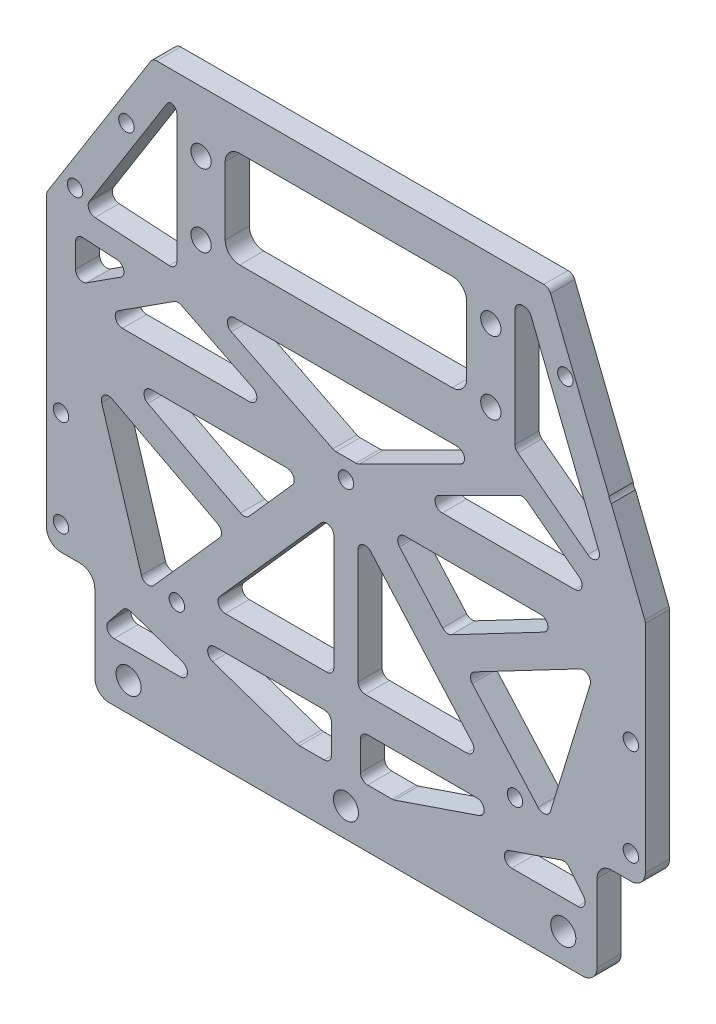
from build123d import *

# Parameters (mm, degrees)
SKETCH_1_W          = 124
SKETCH_1_H          = 120
EXTRUDE_1_DEPTH     = 5
SKETCH_2_R          = 1.6
CUT_EXTRUDE_1_DEPTH = 87.423376467
SKETCH_3_R          = 1.6
CUT_EXTRUDE_2_DEPTH = 87.423376467
SKETCH_4_R          = 2.1
CUT_EXTRUDE_3_DEPTH = 87.423376467
CHAMFER_1_SIZE      = 22
CHAMFER_1_SIZE2     = 35
CHAMFER_2_SIZE      = 50
CHAMFER_2_SIZE2     = 20
SKETCH_7_R          = 2.6
CUT_EXTRUDE_4_DEPTH = 87.423376467
SKETCH_8_R          = 1.6
CUT_EXTRUDE_5_DEPTH = 87.423376467
SKETCH_9_W          = 50
SKETCH_9_H          = 20
CUT_EXTRUDE_6_DEPTH = 10
FILLET_2_R          = 1.5
FILLET_3_R          = 3
EXTRUDE_2_DEPTH     = 5
CUT_EXTRUDE_7_DEPTH = 87.423376467
FILLET_4_R          = 3


with BuildPart() as part:
    # 草图1 → 凸台-拉伸1 (new body)
    with BuildSketch(Plane.XY):
        Rectangle(SKETCH_1_W, SKETCH_1_H)
    extrude(amount=EXTRUDE_1_DEPTH)

    # 草图2 → 切除-拉伸1 (cut, through all)
    with BuildSketch(Plane.XY.offset(5)):
        with Locations((-35, -35)):
            Circle(SKETCH_2_R)
        with Locations((35, -35)):
            Circle(SKETCH_2_R)
    extrude(amount=-CUT_EXTRUDE_1_DEPTH, mode=Mode.SUBTRACT)

    # 草图3 → 切除-拉伸2 (cut, through all)
    with BuildSketch(Plane.XY.offset(5)):
        with Locations((0, 4.5)):
            Circle(SKETCH_3_R)
    extrude(amount=-CUT_EXTRUDE_2_DEPTH, mode=Mode.SUBTRACT)

    # 草图4 → 切除-拉伸3 (cut, through all)
    with BuildSketch(Plane.XY.offset(5)):
        with Locations((-30, 47.5)):
            Circle(SKETCH_4_R)
        with Locations((30, 32.5)):
            Circle(SKETCH_4_R)
        with Locations((30, 47.5)):
            Circle(SKETCH_4_R)
        with Locations((-30, 32.5)):
            Circle(SKETCH_4_R)
    extrude(amount=-CUT_EXTRUDE_3_DEPTH, mode=Mode.SUBTRACT)

    # 倒角1
    chamfer_1_edges = [part.edges().sort_by_distance(p)[0] for p in [
        (-62, 60, 2.5),
    ]]
    chamfer_1_side = [part.faces().sort_by_distance(p)[0] for p in [
        (0, 60, 2.5),
    ]]
    chamfer(chamfer_1_edges, length=CHAMFER_1_SIZE, length2=CHAMFER_1_SIZE2, reference=chamfer_1_side[0])

    # 倒角2
    chamfer_2_edges = [part.edges().sort_by_distance(p)[0] for p in [
        (62, 60, 2.5),
    ]]
    chamfer_2_side = [part.faces().sort_by_distance(p)[0] for p in [
        (62, 0, 2.5),
    ]]
    chamfer(chamfer_2_edges, length=CHAMFER_2_SIZE, length2=CHAMFER_2_SIZE2, reference=chamfer_2_side[0])

    # 草图7 → 切除-拉伸4 (cut, through all)
    with BuildSketch(Plane.XY.offset(5)):
        with Locations((-45, -54)):
            Circle(SKETCH_7_R)
        with Locations((0, -54)):
            Circle(SKETCH_7_R)
        with Locations((45, -54)):
            Circle(SKETCH_7_R)
    extrude(amount=-CUT_EXTRUDE_4_DEPTH, mode=Mode.SUBTRACT)

    # 草图8 → 切除-拉伸5 (cut, through all)
    with BuildSketch(Plane(origin=(0, 0, 0), x_dir=(-1, 0, 0), z_dir=(0, 0, -1))):
        with Locations((-59, -33)):
            Circle(SKETCH_8_R)
        with Locations((-59, -13)):
            Circle(SKETCH_8_R)
        with Locations((45.442663531, 45.703937126)):
            Circle(SKETCH_8_R)
        with Locations((56.086094435, 28.771206142)):
            Circle(SKETCH_8_R)
    cut_extrude_5 = extrude(amount=-CUT_EXTRUDE_5_DEPTH, mode=Mode.SUBTRACT)

    # 草图9 → 切除-拉伸6 (cut)
    with BuildSketch(Plane.XY.offset(5)):
        Polygon((-20.795143669, -12.937322966), (-8.888654966, 0.5), (-46.405227211, 0.5), align=None)
        Polygon((46.405227211, 0.5), (8.888654966, 0.5), (20.795143669, -12.937322966), align=None)
        Polygon((36.651188431, 20.030509243), (13.590169944, 8.5), (51.861647432, 8.5), align=None)
        Polygon((-51.376856395, 8.5), (-13.590169944, 8.5), (-34.845181073, 19.127505564), align=None)
        Polygon((-2.409830056, 8.5), (2.409830056, 8.5), (29.409830056, 22), (-29.409830056, 22), align=None)
        with Locations((0, 42)):
            Rectangle(SKETCH_9_W, SKETCH_9_H)
        Polygon((56, -48), (56, -9.733809511), (47.224115046, -38.355523672), align=None)
        Polygon((-56, 20.766320607), (-56, 11.472020889), (-42.786156177, 19.966634775), align=None)
        Polygon((-47.224115046, -38.355523672), (-56, -9.733809511), (-56, -48), align=None)
        Polygon((-54.483388829, 25.683685076), (-35, 24.504573971), (-35, 54), (-36.684562306, 54), align=None)
        Polygon((-41.557478496, -36.369100842), (-24.893558667, -17.562677034), (-51.624213171, -3.53740308), align=None)
        Polygon((51.624213171, -3.53740308), (24.893558667, -17.562677034), (41.557478496, -36.369100842), align=None)
        Polygon((51.155461986, -48), (45.560495731, -41.070588478), (25.28565897, -48), align=None)
        Polygon((35, 27.556493075), (54.396821993, 12.852450597), (37.937802231, 54), (35, 54), align=None)
        Polygon((-25.28565897, -48), (-45.560495731, -41.070588478), (-51.155461986, -48), align=None)
        Polygon((9.825265002, -48), (36.158457982, -39), (3, -39), (3, -48), align=None)
        Polygon((-3, -39), (-36.158457982, -39), (-9.825265002, -48), (-3, -48), align=None)
        Polygon((2.5, -32), (28.333508776, -32), (2.5, -2.845040096), align=None)
        Polygon((-2.5, -32), (-2.5, -2.845040096), (-28.333508776, -32), align=None)
    extrude(amount=-CUT_EXTRUDE_6_DEPTH, mode=Mode.SUBTRACT)

    # 圆角2
    # the kernel refuses this fillet: 1.5 mm, written as the material it adds along each edge
    with BuildSketch(Plane(origin=(-20.795143669, -12.937322966, 5), x_dir=(-0.8855113060794975, 0.46461782876400964, 0), z_dir=(0, 0, -1))) as fillet_2_piece_1:
        with BuildLine():
            CenterArc((FILLET_2_R * 0.783284708727, FILLET_2_R), FILLET_2_R, 193.857889439, 76.142110561)
            Line((-FILLET_2_R * 0.187608070565, FILLET_2_R * 0.760485467833), (0, 0))
            Line((0, 0), (FILLET_2_R * 0.783284708727, 0))
        make_face()
    extrude(amount=5)
    with BuildSketch(Plane(origin=(-46.405227211, 0.5, 5), x_dir=(0.8855113060794989, -0.4646178287640068, 0), z_dir=(0, 0, -1))) as fillet_2_piece_2:
        with BuildLine():
            CenterArc((FILLET_2_R * 4.05819835002, -FILLET_2_R), FILLET_2_R, 90, 152.314508611)
            Line((FILLET_2_R * 3.59358052125, -FILLET_2_R * 1.88551130608), (0, 0))
            Line((0, 0), (FILLET_2_R * 4.05819835002, 0))
        make_face()
    extrude(amount=5)
    with BuildSketch(Plane(origin=(-8.888654966, 0.5, 5), x_dir=(-1, 0, 0), z_dir=(0, 0, -1)), Plane(origin=(-28.333508776, -32, 5), x_dir=(1, 0, 0), z_dir=(0, 0, -1)), Plane(origin=(28.333508776, -32, 5), x_dir=(-0.6631869212816371, 0.7484538111607045, 0), z_dir=(0, 0, -1)), Plane(origin=(8.888654966, 0.5, 5), x_dir=(0.663186921281637, -0.7484538111607046, 0), z_dir=(0, 0, -1))) as fillet_2_piece_3:
        with BuildLine():
            CenterArc((FILLET_2_R * 2.22216374141, -FILLET_2_R), FILLET_2_R, 90, 131.543380828)
            Line((FILLET_2_R * 1.47370993025, -FILLET_2_R * 1.66318692128), (0, 0))
            Line((0, 0), (FILLET_2_R * 2.22216374141, 0))
        make_face()
    extrude(amount=5)
    with BuildSketch(Plane(origin=(-47.224115046, -38.355523672, 5), x_dir=(-0.2931459684588604, 0.9560676969630952, 0), z_dir=(0, 0, -1)), Plane(origin=(47.224115046, -38.355523672, 5), x_dir=(0.673016151793855, -0.7396277843784607, 0), z_dir=(0, 0, -1))) as fillet_2_piece_4:
        with BuildLine():
            CenterArc((FILLET_2_R * 0.569773364902, -FILLET_2_R), FILLET_2_R, 90, 59.346676613)
            Line((-FILLET_2_R * 0.290494540513, -FILLET_2_R * 0.490157739185), (0, 0))
            Line((0, 0), (FILLET_2_R * 0.569773364902, 0))
        make_face()
    extrude(amount=5)
    with BuildSketch(Plane(origin=(-56, -48, 5), x_dir=(0.6730161517938523, 0.7396277843784631, 0), z_dir=(0, 0, -1)), Plane(origin=(56, -48, 5), x_dir=(0, 1, 0), z_dir=(0, 0, -1))) as fillet_2_piece_5:
        with BuildLine():
            CenterArc((FILLET_2_R * 2.58482323157, -FILLET_2_R), FILLET_2_R, 90, 137.699718158)
            Line((FILLET_2_R * 1.91180707978, -FILLET_2_R * 1.73962778438), (0, 0))
            Line((0, 0), (FILLET_2_R * 2.58482323157, 0))
        make_face()
    extrude(amount=5)
    with BuildSketch(Plane(origin=(-56, -9.733809511, 5), x_dir=(0.2931459684588615, -0.956067696963095, 0), z_dir=(0, 0, -1)), Plane(origin=(56, -9.733809511, 5), x_dir=(0, -1, 0), z_dir=(0, 0, -1))) as fillet_2_piece_6:
        with BuildLine():
            CenterArc((FILLET_2_R * 6.6726747335, FILLET_2_R), FILLET_2_R, 107.046394772, 162.953605228)
            Line((FILLET_2_R * 6.37952876504, FILLET_2_R * 1.95606769696), (0, 0))
            Line((0, 0), (FILLET_2_R * 6.6726747335, 0))
        make_face()
    extrude(amount=5)
    with BuildSketch(Plane(origin=(-2.5, -2.845040096, 5), x_dir=(-0.663186921281637, -0.7484538111607046, 0), z_dir=(0, 0, -1)), Plane(origin=(2.5, -2.845040096, 5), x_dir=(0, -1, 0), z_dir=(0, 0, -1))) as fillet_2_piece_7:
        with BuildLine():
            CenterArc((FILLET_2_R * 2.63644193673, -FILLET_2_R), FILLET_2_R, 90, 138.456619172)
            Line((FILLET_2_R * 1.97325501545, -FILLET_2_R * 1.74845381116), (0, 0))
            Line((0, 0), (FILLET_2_R * 2.63644193673, 0))
        make_face()
    extrude(amount=5)
    with BuildSketch(Plane(origin=(-2.5, -32, 5), x_dir=(-1, 0, 0), z_dir=(0, 0, -1)), Plane(origin=(2.5, -32, 5), x_dir=(0, 1, 0), z_dir=(0, 0, -1)), Plane(origin=(-3, -48, 5), x_dir=(-1, 0, 0), z_dir=(0, 0, -1))) as fillet_2_piece_8:
        with BuildLine():
            CenterArc((FILLET_2_R, FILLET_2_R), FILLET_2_R, 180, 90)
            Line((0, FILLET_2_R), (0, 0))
            Line((0, 0), (FILLET_2_R, 0))
        make_face()
    extrude(amount=5)
    with BuildSketch(Plane(origin=(3, -48, 5), x_dir=(1, 0, 0), z_dir=(0, 0, -1)), Plane(origin=(3, -39, 5), x_dir=(0, -1, 0), z_dir=(0, 0, -1)), Plane(origin=(-3, -39, 5), x_dir=(-1, 0, 0), z_dir=(0, 0, -1)), Plane(origin=(-35, 54, 5), x_dir=(-1, 0, 0), z_dir=(0, 0, -1)), Plane(origin=(35, 54, 5), x_dir=(0, -1, 0), z_dir=(0, 0, -1))) as fillet_2_piece_9:
        with BuildLine():
            CenterArc((FILLET_2_R, -FILLET_2_R), FILLET_2_R, 90, 90)
            Line((0, -FILLET_2_R), (0, 0))
            Line((0, 0), (FILLET_2_R, 0))
        make_face()
    extrude(amount=5)
    with BuildSketch(Plane(origin=(36.158457982, -39, 5), x_dir=(-0.946259952100711, -0.3234070238111103, 0), z_dir=(0, 0, -1))) as fillet_2_piece_10:
        with BuildLine():
            CenterArc((FILLET_2_R * 6.01798912456, FILLET_2_R), FILLET_2_R, 108.86909291, 161.13090709)
            Line((FILLET_2_R * 5.69458210075, FILLET_2_R * 1.9462599521), (0, 0))
            Line((0, 0), (FILLET_2_R * 6.01798912456, 0))
        make_face()
    extrude(amount=5)
    with BuildSketch(Plane(origin=(9.825265002, -48, 5), x_dir=(0.9462599521007252, 0.3234070238110687, 0), z_dir=(0, 0, -1)), Plane(origin=(-9.825265002, -48, 5), x_dir=(1, 0, 0), z_dir=(0, 0, -1))) as fillet_2_piece_11:
        with BuildLine():
            CenterArc((FILLET_2_R * 0.166168462472, -FILLET_2_R), FILLET_2_R, 90, 18.86909291)
            Line((-FILLET_2_R * 0.157238561339, -FILLET_2_R * 0.0537400478993), (0, 0))
            Line((0, 0), (FILLET_2_R * 0.166168462472, 0))
        make_face()
    extrude(amount=5)
    with BuildSketch(Plane(origin=(25.28565897, -48, 5), x_dir=(1, 0, 0), z_dir=(0, 0, -1)), Plane(origin=(-36.158457982, -39, 5), x_dir=(0.946259952100711, -0.3234070238111103, 0), z_dir=(0, 0, -1)), Plane(origin=(-25.28565897, -48, 5), x_dir=(-0.9462599521007113, 0.32340702381110964, 0), z_dir=(0, 0, -1))) as fillet_2_piece_12:
        with BuildLine():
            CenterArc((FILLET_2_R * 6.01798912456, -FILLET_2_R), FILLET_2_R, 90, 161.13090709)
            Line((FILLET_2_R * 5.69458210075, -FILLET_2_R * 1.9462599521), (0, 0))
            Line((0, 0), (FILLET_2_R * 6.01798912456, 0))
        make_face()
    extrude(amount=5)
    with BuildSketch(Plane(origin=(45.560495731, -41.070588478, 5), x_dir=(0.6282102919478427, -0.7780435907394947, 0), z_dir=(0, 0, -1)), Plane(origin=(-45.560495731, -41.070588478, 5), x_dir=(0.9462599521007107, -0.3234070238111115, 0), z_dir=(0, 0, -1))) as fillet_2_piece_13:
        with BuildLine():
            CenterArc((FILLET_2_R * 0.699569025654, FILLET_2_R), FILLET_2_R, 200.049111296, 69.950888704)
            Line((-FILLET_2_R * 0.239830086098, FILLET_2_R * 0.657174521309), (0, 0))
            Line((0, 0), (FILLET_2_R * 0.699569025654, 0))
        make_face()
    extrude(amount=5)
    with BuildSketch(Plane(origin=(51.155461986, -48, 5), x_dir=(-0.6282102919478418, 0.7780435907394954, 0), z_dir=(0, 0, -1)), Plane(origin=(-51.155461986, -48, 5), x_dir=(1, 0, 0), z_dir=(0, 0, -1))) as fillet_2_piece_14:
        with BuildLine():
            CenterArc((FILLET_2_R * 2.09269803302, -FILLET_2_R), FILLET_2_R, 90, 128.918204205)
            Line((FILLET_2_R * 1.31465444228, -FILLET_2_R * 1.62821029195), (0, 0))
            Line((0, 0), (FILLET_2_R * 2.09269803302, 0))
        make_face()
    extrude(amount=5)
    with BuildSketch(Plane(origin=(46.405227211, 0.5, 5), x_dir=(-0.8855113060794988, -0.46461782876400726, 0), z_dir=(0, 0, -1))) as fillet_2_piece_15:
        with BuildLine():
            CenterArc((FILLET_2_R * 4.05819835002, FILLET_2_R), FILLET_2_R, 117.685491389, 152.314508611)
            Line((FILLET_2_R * 3.59358052125, FILLET_2_R * 1.88551130608), (0, 0))
            Line((0, 0), (FILLET_2_R * 4.05819835002, 0))
        make_face()
    extrude(amount=5)
    with BuildSketch(Plane(origin=(20.795143669, -12.937322966, 5), x_dir=(0.8855113060794993, 0.46461782876400604, 0), z_dir=(0, 0, -1))) as fillet_2_piece_16:
        with BuildLine():
            CenterArc((FILLET_2_R * 0.783284708727, -FILLET_2_R), FILLET_2_R, 90, 76.142110561)
            Line((-FILLET_2_R * 0.187608070565, -FILLET_2_R * 0.760485467833), (0, 0))
            Line((0, 0), (FILLET_2_R * 0.783284708727, 0))
        make_face()
    extrude(amount=5)
    with BuildSketch(Plane(origin=(-35, 24.504573971, 5), x_dir=(0, 1, 0), z_dir=(0, 0, -1)), Plane(origin=(-56, 20.766320607, 5), x_dir=(0, -1, 0), z_dir=(0, 0, -1))) as fillet_2_piece_17:
        with BuildLine():
            CenterArc((FILLET_2_R * 1.06234837763, -FILLET_2_R), FILLET_2_R, 90, 93.463247259)
            Line((FILLET_2_R * 0.064174624583, -FILLET_2_R * 1.06040826713), (0, 0))
            Line((0, 0), (FILLET_2_R * 1.06234837763, 0))
        make_face()
    extrude(amount=5)
    with BuildSketch(Plane(origin=(-54.483388829, 25.683685076, 5), x_dir=(0.5321715452183424, 0.846636549211007, 0), z_dir=(0, 0, -1))) as fillet_2_piece_18:
        with BuildLine():
            CenterArc((FILLET_2_R * 1.68717716114, FILLET_2_R), FILLET_2_R, 151.310952118, 118.689047882)
            Line((FILLET_2_R * 0.809939218483, FILLET_2_R * 1.48005582172), (0, 0))
            Line((0, 0), (FILLET_2_R * 1.68717716114, 0))
        make_face()
    extrude(amount=5)
    with BuildSketch(Plane(origin=(-36.684562306, 54, 5), x_dir=(-0.5321715452183408, -0.8466365492110081, 0), z_dir=(0, 0, -1))) as fillet_2_piece_19:
        with BuildLine():
            CenterArc((FILLET_2_R * 0.552572949063, -FILLET_2_R), FILLET_2_R, 90, 57.847704859)
            Line((-FILLET_2_R * 0.294063600148, -FILLET_2_R * 0.467828454782), (0, 0))
            Line((0, 0), (FILLET_2_R * 0.552572949063, 0))
        make_face()
    extrude(amount=5)
    with BuildSketch(Plane(origin=(-42.786156177, 19.966634775, 5), x_dir=(-0.9981737530420696, 0.060408267132153484, 0), z_dir=(0, 0, -1))) as fillet_2_piece_20:
        with BuildLine():
            CenterArc((FILLET_2_R * 3.05964186518, -FILLET_2_R), FILLET_2_R, 90, 143.801526468)
            Line((FILLET_2_R * 2.46905769673, -FILLET_2_R * 1.80697604672), (0, 0))
            Line((0, 0), (FILLET_2_R * 3.05964186518, 0))
        make_face()
    extrude(amount=5)
    with BuildSketch(Plane(origin=(-56, 11.472020889, 5), x_dir=(0, 1, 0), z_dir=(0, 0, -1))) as fillet_2_piece_21:
        with BuildLine():
            CenterArc((FILLET_2_R * 1.83166549836, FILLET_2_R), FILLET_2_R, 147.264773728, 122.735226272)
            Line((FILLET_2_R * 0.990487022987, FILLET_2_R * 1.54075759131), (0, 0))
            Line((0, 0), (FILLET_2_R * 1.83166549836, 0))
        make_face()
    extrude(amount=5)
    with BuildSketch(Plane(origin=(-29.409830056, 22, 5), x_dir=(0.8944271909999193, -0.447213595499951, 0), z_dir=(0, 0, -1)), Plane(origin=(29.409830056, 22, 5), x_dir=(-1, 0, 0), z_dir=(0, 0, -1))) as fillet_2_piece_22:
        with BuildLine():
            CenterArc((FILLET_2_R * 4.2360679775, -FILLET_2_R), FILLET_2_R, 90, 153.434948823)
            Line((FILLET_2_R * 3.788854382, -FILLET_2_R * 1.894427191), (0, 0))
            Line((0, 0), (FILLET_2_R * 4.2360679775, 0))
        make_face()
    extrude(amount=5)
    with BuildSketch(Plane(origin=(2.409830056, 8.5, 5), x_dir=(0.8944271909999179, 0.4472135954999539, 0), z_dir=(0, 0, -1))) as fillet_2_piece_23:
        with BuildLine():
            CenterArc((FILLET_2_R * 0.2360679775, -FILLET_2_R), FILLET_2_R, 90, 26.565051177)
            Line((-FILLET_2_R * 0.211145618, -FILLET_2_R * 0.105572809), (0, 0))
            Line((0, 0), (FILLET_2_R * 0.2360679775, 0))
        make_face()
    extrude(amount=5)
    with BuildSketch(Plane(origin=(-2.409830056, 8.5, 5), x_dir=(-0.8944271909999199, 0.4472135954999499, 0), z_dir=(0, 0, -1))) as fillet_2_piece_24:
        with BuildLine():
            CenterArc((FILLET_2_R * 0.2360679775, FILLET_2_R), FILLET_2_R, 243.434948823, 26.565051177)
            Line((-FILLET_2_R * 0.211145618, FILLET_2_R * 0.105572809), (0, 0))
            Line((0, 0), (FILLET_2_R * 0.2360679775, 0))
        make_face()
    extrude(amount=5)
    with BuildSketch(Plane(origin=(13.590169944, 8.5, 5), x_dir=(0.8944271909999199, 0.44721359549995016, 0), z_dir=(0, 0, -1)), Plane(origin=(-13.590169944, 8.5, 5), x_dir=(-1, 0, 0), z_dir=(0, 0, -1))) as fillet_2_piece_25:
        with BuildLine():
            CenterArc((FILLET_2_R * 4.2360679775, FILLET_2_R), FILLET_2_R, 116.565051177, 153.434948823)
            Line((FILLET_2_R * 3.788854382, FILLET_2_R * 1.894427191), (0, 0))
            Line((0, 0), (FILLET_2_R * 4.2360679775, 0))
        make_face()
    extrude(amount=5)
    with BuildSketch(Plane(origin=(36.651188431, 20.030509243, 5), x_dir=(-0.8944271909999189, -0.4472135954999518, 0), z_dir=(0, 0, -1))) as fillet_2_piece_26:
        with BuildLine():
            CenterArc((FILLET_2_R * 0.62159223034, -FILLET_2_R), FILLET_2_R, 90, 63.729526071)
            Line((-FILLET_2_R * 0.27512240761, -FILLET_2_R * 0.557390851781), (0, 0))
            Line((0, 0), (FILLET_2_R * 0.62159223034, 0))
        make_face()
    extrude(amount=5)
    with BuildSketch(Plane(origin=(51.861647432, 8.5, 5), x_dir=(-0.7969046345270256, 0.6041051261737046, 0), z_dir=(0, 0, -1))) as fillet_2_piece_27:
        with BuildLine():
            CenterArc((FILLET_2_R * 2.97448996321, -FILLET_2_R), FILLET_2_R, 90, 142.835525106)
            Line((FILLET_2_R * 2.37038483704, -FILLET_2_R * 1.79690463453), (0, 0))
            Line((0, 0), (FILLET_2_R * 2.97448996321, 0))
        make_face()
    extrude(amount=5)
    with BuildSketch(Plane(origin=(-34.845181073, 19.127505564, 5), x_dir=(-0.8411784753765612, -0.540757591313487, 0), z_dir=(0, 0, -1))) as fillet_2_piece_28:
        with BuildLine():
            CenterArc((FILLET_2_R * 0.569237129121, -FILLET_2_R), FILLET_2_R, 90, 59.300277449)
            Line((-FILLET_2_R * 0.29061761472, -FILLET_2_R * 0.489461245845), (0, 0))
            Line((0, 0), (FILLET_2_R * 0.569237129121, 0))
        make_face()
    extrude(amount=5)
    with BuildSketch(Plane(origin=(-51.376856395, 8.5, 5), x_dir=(1, 0, 0), z_dir=(0, 0, -1))) as fillet_2_piece_29:
        with BuildLine():
            CenterArc((FILLET_2_R * 3.40481299745, -FILLET_2_R), FILLET_2_R, 90, 147.264773728)
            Line((FILLET_2_R * 2.86405540614, -FILLET_2_R * 1.84117847538), (0, 0))
            Line((0, 0), (FILLET_2_R * 3.40481299745, 0))
        make_face()
    extrude(amount=5)
    with BuildSketch(Plane(origin=(-51.624213171, -3.53740308, 5), x_dir=(0.29314596845886026, -0.9560676969630952, 0), z_dir=(0, 0, -1)), Plane(origin=(51.624213171, -3.53740308, 5), x_dir=(-0.8855113060794988, -0.464617828764007, 0), z_dir=(0, 0, -1))) as fillet_2_piece_30:
        with BuildLine():
            CenterArc((FILLET_2_R * 2.39832656555, -FILLET_2_R), FILLET_2_R, 90, 134.731886161)
            Line((FILLET_2_R * 1.68791865389, -FILLET_2_R * 1.70379016692), (0, 0))
            Line((0, 0), (FILLET_2_R * 2.39832656555, 0))
        make_face()
    extrude(amount=5)
    with BuildSketch(Plane(origin=(-24.893558667, -17.562677034, 5), x_dir=(-0.6631869212816379, -0.748453811160704, 0), z_dir=(0, 0, -1)), Plane(origin=(24.893558667, -17.562677034, 5), x_dir=(0.8855113060794996, 0.46461782876400576, 0), z_dir=(0, 0, -1))) as fillet_2_piece_31:
        with BuildLine():
            CenterArc((FILLET_2_R * 1.27667499296, FILLET_2_R), FILLET_2_R, 166.142110561, 103.857889439)
            Line((FILLET_2_R * 0.305782213669, FILLET_2_R * 1.23951453217), (0, 0))
            Line((0, 0), (FILLET_2_R * 1.27667499296, 0))
        make_face()
    extrude(amount=5)
    with BuildSketch(Plane(origin=(-41.557478496, -36.369100842, 5), x_dir=(0.6631869212816383, 0.7484538111607038, 0), z_dir=(0, 0, -1)), Plane(origin=(41.557478496, -36.369100842, 5), x_dir=(0.29314596845886154, 0.9560676969630948, 0), z_dir=(0, 0, -1))) as fillet_2_piece_32:
        with BuildLine():
            CenterArc((FILLET_2_R * 1.78235165433, -FILLET_2_R), FILLET_2_R, 90, 121.4102244)
            Line((FILLET_2_R * 0.92889384453, -FILLET_2_R * 1.52116193921), (0, 0))
            Line((0, 0), (FILLET_2_R * 1.78235165433, 0))
        make_face()
    extrude(amount=5)
    with BuildSketch(Plane(origin=(35, 27.556493075, 5), x_dir=(0.7969046345270255, -0.6041051261737048, 0), z_dir=(0, 0, -1))) as fillet_2_piece_33:
        with BuildLine():
            CenterArc((FILLET_2_R * 0.496790778562, -FILLET_2_R), FILLET_2_R, 90, 52.835525106)
            Line((-FILLET_2_R * 0.300113855965, -FILLET_2_R * 0.395894873826), (0, 0))
            Line((0, 0), (FILLET_2_R * 0.496790778562, 0))
        make_face()
    extrude(amount=5)
    with BuildSketch(Plane(origin=(37.937802231, 54, 5), x_dir=(0.3713906763541013, -0.9284766908852602, 0), z_dir=(0, 0, -1))) as fillet_2_piece_34:
        with BuildLine():
            CenterArc((FILLET_2_R * 0.677032961427, FILLET_2_R), FILLET_2_R, 201.801409486, 68.198590514)
            Line((-FILLET_2_R * 0.251443729458, FILLET_2_R * 0.628609323646), (0, 0))
            Line((0, 0), (FILLET_2_R * 0.677032961427, 0))
        make_face()
    extrude(amount=5)
    with BuildSketch(Plane(origin=(54.396821993, 12.852450597, 5), x_dir=(-0.3713906763541008, 0.9284766908852605, 0), z_dir=(0, 0, -1))) as fillet_2_piece_35:
        with BuildLine():
            CenterArc((FILLET_2_R * 3.6017192565, -FILLET_2_R), FILLET_2_R, 90, 148.96588438)
            Line((FILLET_2_R * 3.08617088988, -FILLET_2_R * 1.8568604797), (0, 0))
            Line((0, 0), (FILLET_2_R * 3.6017192565, 0))
        make_face()
    extrude(amount=5)
    # the kernel refuses this fillet: 1.5 mm, written as the material it takes off along each edge
    with BuildSketch(Plane(origin=(-62, 25, -1.080690889), x_dir=(0.532171545218355, 0.8466365492109991, 0), z_dir=(0, 0, 1))) as fillet_2_2_piece_1:
        with BuildLine():
            CenterArc((FILLET_2_R * 0.288184237145, -FILLET_2_R), FILLET_2_R, 90, 32.152295141)
            Line((-FILLET_2_R * 0.243987308073, -FILLET_2_R * 0.153363450789), (0, 0))
            Line((0, 0), (FILLET_2_R * 0.288184237145, 0))
        make_face()
    extrude(amount=7.161381779, mode=Mode.SUBTRACT)
    with BuildSketch(Plane(origin=(-40, 60, -2.072148559), x_dir=(1, 0, 0), z_dir=(0, 0, 1))) as fillet_2_2_piece_2:
        with BuildLine():
            CenterArc((FILLET_2_R * 0.552572949063, -FILLET_2_R), FILLET_2_R, 90, 57.847704859)
            Line((-FILLET_2_R * 0.294063600148, -FILLET_2_R * 0.467828454782), (0, 0))
            Line((0, 0), (FILLET_2_R * 0.552572949063, 0))
        make_face()
    extrude(amount=9.144297118, mode=Mode.SUBTRACT)
    with BuildSketch(Plane(origin=(42, 60, -2.538873605), x_dir=(-1, 0, 0), z_dir=(0, 0, 1))) as fillet_2_2_piece_3:
        with BuildLine():
            CenterArc((FILLET_2_R * 0.677032961427, FILLET_2_R), FILLET_2_R, 201.801409486, 68.198590514)
            Line((-FILLET_2_R * 0.251443729458, FILLET_2_R * 0.628609323646), (0, 0))
            Line((0, 0), (FILLET_2_R * 0.677032961427, 0))
        make_face()
    extrude(amount=10.077747211, mode=Mode.SUBTRACT)
    with BuildSketch(Plane(origin=(62, 10, -0.722184013), x_dir=(-0.3713906763541143, 0.9284766908852551, 0), z_dir=(0, 0, 1))) as fillet_2_2_piece_4:
        with BuildLine():
            CenterArc((FILLET_2_R * 0.192582403567, FILLET_2_R), FILLET_2_R, 248.198590514, 21.801409486)
            Line((-FILLET_2_R * 0.178808272787, FILLET_2_R * 0.0715233091147), (0, 0))
            Line((0, 0), (FILLET_2_R * 0.192582403567, 0))
        make_face()
    extrude(amount=6.444368027, mode=Mode.SUBTRACT)
    with BuildSketch(Plane(origin=(62, -60, -3.75), x_dir=(0, 1, 0), z_dir=(0, 0, 1))) as fillet_2_2_piece_5:
        with BuildLine():
            CenterArc((FILLET_2_R, FILLET_2_R), FILLET_2_R, 180, 90)
            Line((0, FILLET_2_R), (0, 0))
            Line((0, 0), (FILLET_2_R, 0))
        make_face()
    extrude(amount=12.5, mode=Mode.SUBTRACT)
    with BuildSketch(Plane(origin=(-62, -60, -3.75), x_dir=(0, 1, 0), z_dir=(0, 0, 1))) as fillet_2_2_piece_6:
        with BuildLine():
            CenterArc((FILLET_2_R, -FILLET_2_R), FILLET_2_R, 90, 90)
            Line((0, -FILLET_2_R), (0, 0))
            Line((0, 0), (FILLET_2_R, 0))
        make_face()
    extrude(amount=12.5, mode=Mode.SUBTRACT)

    # 圆角3
    fillet_3_edges = [part.edges().sort_by_distance(p)[0] for p in [
        (-25, 52, 2.5),
        (25, 52, 2.5),
        (25, 32, 2.5),
        (-25, 32, 2.5),
    ]]
    fillet(fillet_3_edges, radius=FILLET_3_R)

    # 镜向1: 切除-拉伸5 across plane
    add(cut_extrude_5.mirror(Plane(origin=(0, 0, 0), x_dir=(0, 0, 1), z_dir=(1, 0, 0))), mode=Mode.SUBTRACT)

    # 草图11 → 凸台-拉伸2 (add)
    with BuildSketch(Plane.XY.offset(5)):
        with BuildLine():
            Line((47.474655193, -37.538410809), (53.065898455, -19.303102658))
            ThreePointArc((53.065898455, -19.303102658), (54.722314734, -18.259387703), (56, -19.742821611))
            Line((56, -19.742821611), (56, -44.122765153))
            ThreePointArc((56, -44.122765153), (55.041219681, -45.521722356), (53.390558323, -45.13228938))
            Line((53.390558323, -45.13228938), (47.799315062, -38.987653989))
            ThreePointArc((47.799315062, -38.987653989), (47.445035632, -38.306032979), (47.474655193, -37.538410809))
        make_face()
        with BuildLine():
            Line((-56, -44.122765153), (-56, -19.742821611))
            ThreePointArc((-56, -19.742821611), (-54.722314734, -18.259387703), (-53.065898455, -19.303102658))
            Line((-53.065898455, -19.303102658), (-47.474655193, -37.538410809))
            ThreePointArc((-47.474655193, -37.538410809), (-47.445035632, -38.306032979), (-47.799315062, -38.987653989))
            Line((-47.799315062, -38.987653989), (-53.390558323, -45.13228938))
            ThreePointArc((-53.390558323, -45.13228938), (-55.041219681, -45.521722356), (-56, -44.122765153))
        make_face()
    extrude(amount=-EXTRUDE_2_DEPTH)

    # 草图10 → 切除-拉伸7 (cut, through all)
    with BuildSketch(Plane(origin=(0, 0, 0), x_dir=(-1, 0, 0), z_dir=(0, 0, -1))):
        with BuildLine():
            Line((-62, -58.5), (-62, -38))
            Line((-62, -38), (-52, -38))
            Line((-52, -38), (-52, -60))
            Line((-52, -60), (-60.5, -60))
            ThreePointArc((-60.5, -60), (-61.560660172, -59.560660172), (-62, -58.5))
        make_face()
        with BuildLine():
            Line((52, -60), (60.5, -60))
            ThreePointArc((60.5, -60), (61.560660172, -59.560660172), (62, -58.5))
            Line((62, -58.5), (62, -38))
            Line((62, -38), (52, -38))
            Line((52, -38), (52, -60))
        make_face()
    extrude(amount=-CUT_EXTRUDE_7_DEPTH, mode=Mode.SUBTRACT)

    # 圆角4
    fillet_4_edges = [part.edges().sort_by_distance(p)[0] for p in [
        (-52, -60, 2.5),
        (-52, -38, 2.5),
        (-62, -38, 2.5),
        (62, -38, 2.5),
        (52, -38, 2.5),
        (52, -60, 2.5),
    ]]
    fillet(fillet_4_edges, radius=FILLET_4_R)


solid = part.part
